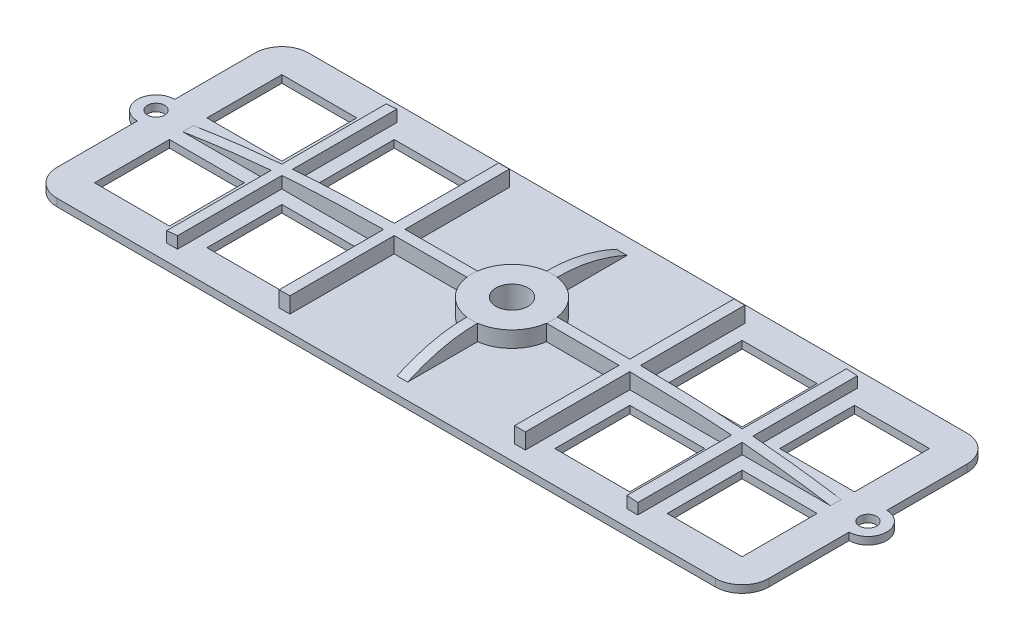
from build123d import *

# Parameters (mm, degrees)
SKETCH1_W            = 14
SKETCH1_H            = 14
BOSS_EXTRUDE1_DEPTH  = 0.7
SKETCH10_R           = 7.5
BOSS_EXTRUDE8_DEPTH  = 3
BOSS_EXTRUDE17_DEPTH = 1
SKETCH24_R           = 3
CUT_EXTRUDE5_DEPTH   = 74.970331891
SKETCH21_W           = 2
SKETCH21_H           = 3
BOSS_EXTRUDE20_DEPTH = 0.066966
BOSS_EXTRUDE22_DEPTH = 1
SKETCH26_W           = 2
SKETCH26_H           = 3
BOSS_EXTRUDE23_DEPTH = 0.066966
BOSS_EXTRUDE24_START = 1
BOSS_EXTRUDE24_DEPTH = 19.5
BOSS_EXTRUDE25_START = 1
BOSS_EXTRUDE25_DEPTH = 19.5
SKETCH30_R           = 1.6
CUT_EXTRUDE6_DEPTH   = 74.970342046
FILLET2_R            = 5


# Read off the part's stored shape, not the designer's step: Boss-Extrude24, Boss-Extrude25
with BuildPart() as part:
    # Sketch1 → Boss-Extrude1 (new, symmetric)
    with BuildSketch(Plane(origin=(0, 0, 0), x_dir=(1, 0, 0), z_dir=(0, 1, 0))):
        with BuildLine():
            Line((-66.5, 23.5), (66.5, 23.5))
            Line((66.5, 23.5), (66.5, 3.5))
            ThreePointArc((66.5, 3.5), (70, 0), (66.5, -3.5))
            Line((66.5, -3.5), (66.5, -23.5))
            Line((66.5, -23.5), (-66.5, -23.5))
            Line((-66.5, -23.5), (-66.5, -3.5))
            ThreePointArc((-66.5, -3.5), (-70, 0), (-66.5, 3.5))
            Line((-66.5, 3.5), (-66.5, 23.5))
        make_face()
        with Locations((-53.5, 10.5)):
            Rectangle(SKETCH1_W, SKETCH1_H, mode=Mode.SUBTRACT)
        with Locations((32.5, -10.5)):
            Rectangle(SKETCH1_W, SKETCH1_H, mode=Mode.SUBTRACT)
        with Locations((-53.5, -10.5)):
            Rectangle(SKETCH1_W, SKETCH1_H, mode=Mode.SUBTRACT)
        with Locations((-32.5, -10.5)):
            Rectangle(SKETCH1_W, SKETCH1_H, mode=Mode.SUBTRACT)
        with Locations((-32.5, 10.5)):
            Rectangle(SKETCH1_W, SKETCH1_H, mode=Mode.SUBTRACT)
        with Locations((53.5, -10.5)):
            Rectangle(SKETCH1_W, SKETCH1_H, mode=Mode.SUBTRACT)
        with Locations((32.5, 10.5)):
            Rectangle(SKETCH1_W, SKETCH1_H, mode=Mode.SUBTRACT)
        with Locations((53.5, 10.5)):
            Rectangle(SKETCH1_W, SKETCH1_H, mode=Mode.SUBTRACT)
    extrude(amount=BOSS_EXTRUDE1_DEPTH, both=True)

    # Sketch10 → Boss-Extrude8 (add)
    with BuildSketch(Plane(origin=(0, 0.7, 0), x_dir=(1, 0, 0), z_dir=(0, 1, 0))):
        with Locations(Location((0, 0, 0), (0, 0, 270))):
            Circle(SKETCH10_R)
    extrude(amount=BOSS_EXTRUDE8_DEPTH)

    # Sketch24 → Cut-Extrude5 (cut, through all)
    with BuildSketch(Plane(origin=(0, 3.7, 0), x_dir=(1, 0, 0), z_dir=(0, 1, 0))):
        with Locations(Location((0, 0, 0), (0, 0, 270))):
            Circle(SKETCH24_R)
    extrude(amount=-CUT_EXTRUDE5_DEPTH, mode=Mode.SUBTRACT)



with BuildPart() as body_2:
    # Sketch20 → Boss-Extrude17 (new, symmetric)
    with BuildSketch(Plane(origin=(0, 0, 0), x_dir=(0, 0, -1), z_dir=(1, 0, 0))):
        with BuildLine():
            Line((-7.5, 0.7), (-20.5, 0.7))
            add(Edge.make_bspline(
                [(-7.5, 3.7), (-14.044942682, 3.7), (-20.5, 0.7)],
                knots=[0, 0, 0, 1, 1, 1], degree=2))
            Line((-7.5, 3.7), (-7.5, 0.7))
        make_face()
    extrude(amount=BOSS_EXTRUDE17_DEPTH, both=True)


with BuildPart() as part_1:
    add(part.part)

    add(body_2.part)  # Boss-Extrude20 merges body 2
    # Sketch21 → Boss-Extrude20 (add)
    with BuildSketch(Plane(origin=(0, 0, 7.5), x_dir=(-1, 0, 0), z_dir=(0, 0, -1))):
        with Locations((0, 2.2)):
            Rectangle(SKETCH21_W, SKETCH21_H)
    extrude(amount=BOSS_EXTRUDE20_DEPTH)

    # Mirror8: part across plane


with BuildPart() as part_2:
    add(part_1.part)
    add(part_1.part.mirror(Plane.XY))



with BuildPart() as body_2_2:
    # Sketch15 → Boss-Extrude22 (new, symmetric)
    with BuildSketch(Plane.XY):
        with BuildLine():
            Line((-7.5, 0.7), (-7.5, 3.7))
            add(Edge.make_bspline(
                [(-60.5, 0.7), (-40.998326872, 3.776331264), (-27.192073984, 3.7), (-7.5, 3.7)],
                knots=[0, 0, 0, 0, 1, 1, 1, 1], degree=3))
            Line((-60.5, 0.7), (-7.5, 0.7))
        make_face()
    extrude(amount=BOSS_EXTRUDE22_DEPTH, both=True)


with BuildPart() as part_3:
    add(part_2.part)

    add(body_2_2.part)  # Boss-Extrude23 merges body 2 2
    # Sketch26 → Boss-Extrude23 (add)
    with BuildSketch(Plane(origin=(-7.5, 0, 0), x_dir=(0, 0, -1), z_dir=(1, 0, 0))):
        with Locations((0, 2.2)):
            Rectangle(SKETCH26_W, SKETCH26_H)
    extrude(amount=BOSS_EXTRUDE23_DEPTH)


with BuildPart() as body_2_3:
    # Boss-Extrude24 outline → Boss-Extrude24 (new body)
    with BuildSketch(Plane.XY.offset(BOSS_EXTRUDE24_START)):
        with BuildLine():
            Line((-42, 0.7), (-41.999999997, 2.881262224))
            add(Edge.make_bspline(
                [(-41.999999997, 2.881262224), (-42.663786895, 2.830556642), (-43.330222071, 2.776715505), (-44, 2.719545184)],
                knots=[0.657479323, 0.657479323, 0.657479323, 0.657479323, 0.696620492, 0.696620492, 0.696620492, 0.696620492], degree=3))
            Line((-44, 2.719545184), (-44, 0.7))
            Line((-44, 0.7), (-42, 0.7))
        make_face()
    extrude(amount=BOSS_EXTRUDE24_DEPTH)


with BuildPart() as body_3:
    # Mirror9: mirrored copy
    add(body_2_3.part.mirror(Plane.XY))


with BuildPart() as body_4:
    # Boss-Extrude25 outline → Boss-Extrude25 (new body)
    with BuildSketch(Plane.XY.offset(BOSS_EXTRUDE25_START)):
        with BuildLine():
            Line((-21, 0.7), (-21, 3.667005238))
            add(Edge.make_bspline(
                [(-21, 3.667005238), (-21.670951218, 3.66109998), (-22.337400803, 3.65415318), (-23.000000006, 3.645983261)],
                knots=[0.243398828, 0.243398828, 0.243398828, 0.243398828, 0.281710487, 0.281710487, 0.281710487, 0.281710487], degree=3))
            Line((-23.000000006, 3.645983261), (-23, 0.7))
            Line((-23, 0.7), (-21, 0.7))
        make_face()
    extrude(amount=BOSS_EXTRUDE25_DEPTH)


with BuildPart() as body_5:
    # Mirror10: mirrored copy
    add(body_4.part.mirror(Plane.XY))


with BuildPart() as body_6:
    # Mirror17: mirrored copy
    add(part_3.part.mirror(Plane(origin=(0, 0, 0), x_dir=(0, 0, 1), z_dir=(1, 0, 0))))


with BuildPart() as body_7:
    # Mirror17 2: mirrored copy
    add(body_4.part.mirror(Plane(origin=(0, 0, 0), x_dir=(0, 0, 1), z_dir=(1, 0, 0))))


with BuildPart() as body_8:
    # Mirror17 3: mirrored copy
    add(body_5.part.mirror(Plane(origin=(0, 0, 0), x_dir=(0, 0, 1), z_dir=(1, 0, 0))))


with BuildPart() as body_9:
    # Mirror17 4: mirrored copy
    add(body_3.part.mirror(Plane(origin=(0, 0, 0), x_dir=(0, 0, 1), z_dir=(1, 0, 0))))


with BuildPart() as body_10:
    # Mirror17 5: mirrored copy
    add(body_2_3.part.mirror(Plane(origin=(0, 0, 0), x_dir=(0, 0, 1), z_dir=(1, 0, 0))))


with BuildPart() as cut_extrude6_tool:
    # Sketch30 → Cut-Extrude6 (new, through all)
    with BuildSketch(Plane.XZ.offset(0.7)):
        with Locations(Location((-66.5, 0, 0), (0, 0, 270))):
            Circle(SKETCH30_R)
        with Locations(Location((66.5, 0, 0), (0, 0, 270))):
            Circle(SKETCH30_R)
    extrude(amount=-CUT_EXTRUDE6_DEPTH)


with BuildPart() as part_4:
    add(part_3.part)

    # Cut-Extrude6: cut by cut_extrude6_tool
    add(cut_extrude6_tool.part, mode=Mode.SUBTRACT)


with BuildPart() as body_6_1:
    add(body_6.part)

    # Cut-Extrude6: cut by cut_extrude6_tool
    add(cut_extrude6_tool.part, mode=Mode.SUBTRACT)


with BuildPart() as body_7_1:
    add(body_7.part)

    # Combine1: union body 3, body 10, body 4, part, body 2 3, body 9, body 6, body 8, body 5
    add(body_3.part)
    add(body_10.part)
    add(body_4.part)
    add(part_4.part)
    add(body_2_3.part)
    add(body_9.part)
    add(body_6_1.part)
    add(body_8.part)
    add(body_5.part)

    # Fillet2
    fillet2_edges = [body_7_1.edges().sort_by_distance(p)[0] for p in [
        (-66.5, 0, -23.5),
        (-66.5, 0, 23.5),
        (66.5, 0, 23.5),
        (66.5, 0, -23.5),
    ]]
    fillet(fillet2_edges, radius=FILLET2_R)


solid = body_7_1.part
